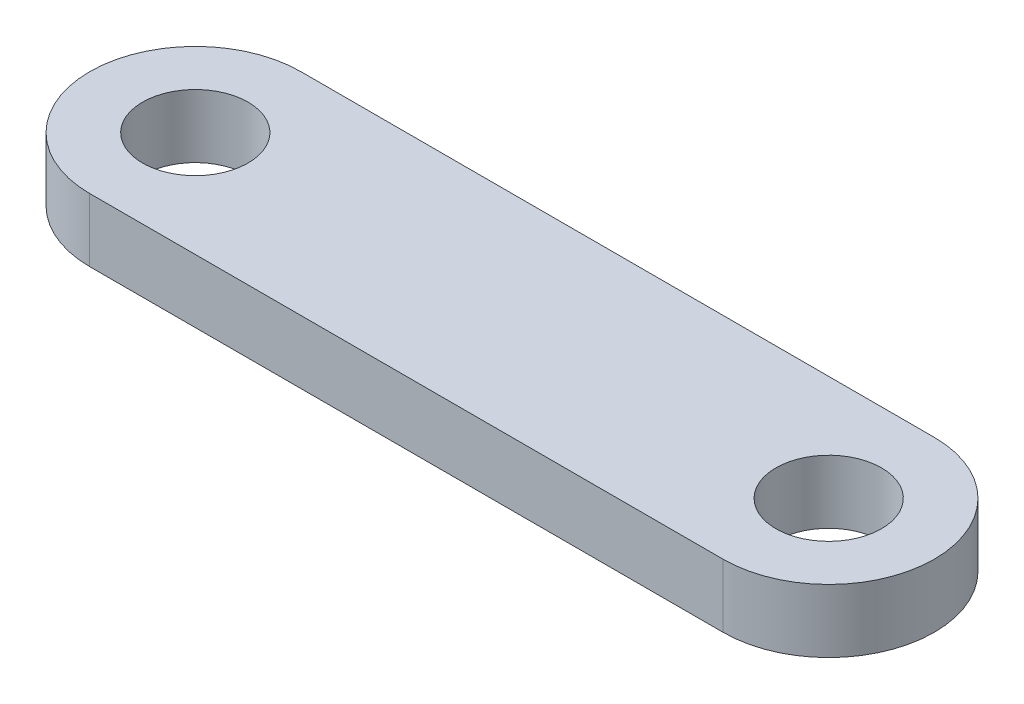
from build123d import *

# Parameters (mm, degrees)
SKETCH1_R           = 3.175
BOSS_EXTRUDE1_DEPTH = 3.81


with BuildPart() as part:
    # Sketch1 → Boss-Extrude1 (new body)
    with BuildSketch(Plane(origin=(0, 0, 0), x_dir=(1, 0, 0), z_dir=(0, 1, 0))):
        with BuildLine():
            Line((-19.05, 6.35), (19.05, 6.35))
            ThreePointArc((19.05, 6.35), (25.4, 0), (19.05, -6.35))
            Line((19.05, -6.35), (-19.05, -6.35))
            ThreePointArc((-19.05, -6.35), (-25.4, 0), (-19.05, 6.35))
        make_face()
        with Locations((-19.05, 0)):
            Circle(SKETCH1_R, mode=Mode.SUBTRACT)
        with Locations((19.05, 0)):
            Circle(SKETCH1_R, mode=Mode.SUBTRACT)
    extrude(amount=BOSS_EXTRUDE1_DEPTH)


solid = part.part
